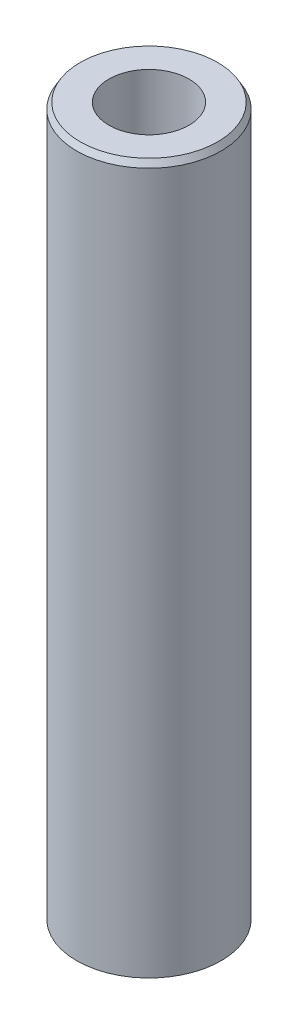
from build123d import *
from OCP.BRepFilletAPI import BRepFilletAPI_MakeChamfer

# Parameters (mm, degrees)
SKETCH1_R           = 15
BOSS_EXTRUDE1_DEPTH = 147.478424563
SKETCH2_R           = 8.311305662
CUT_EXTRUDE1_DEPTH  = 149.99626073
CHAMFER1_SIZE       = 1.275532742
CHAMFER1_SIZE2      = 0.736429172


with BuildPart() as part:
    # Sketch1 → Boss-Extrude1 (new body)
    with BuildSketch(Plane(origin=(0, 0, 0), x_dir=(1, 0, 0), z_dir=(0, 1, 0))):
        Circle(SKETCH1_R)
    extrude(amount=BOSS_EXTRUDE1_DEPTH)

    # Sketch2 → Cut-Extrude1 (cut, through all)
    with BuildSketch(Plane(origin=(0, 0, 0), x_dir=(1, 0, 0), z_dir=(0, 1, 0))):
        Circle(SKETCH2_R)
    extrude(amount=CUT_EXTRUDE1_DEPTH, mode=Mode.SUBTRACT)

    # Chamfer1: one chamfer whose edges measure the first distance from different faces: ONE call of the kernel's chamfer builder (chamfer() names one face for all edges)
    chamfer1_edges_1 = [part.edges().sort_by_distance(p)[0] for p in [
        (-15, 147.478424563, 0),
    ]]
    chamfer1_side_1 = [part.faces().sort_by_distance(p)[0] for p in [
        (-15, 73.739212281, 0),
    ]]
    chamfer1_edges_2 = [part.edges().sort_by_distance(p)[0] for p in [
        (-15, 0, 0),
    ]]
    chamfer1_side_2 = [part.faces().sort_by_distance(p)[0] for p in [
        (-14.575735931, 0, 0),
    ]]
    chamfer1 = BRepFilletAPI_MakeChamfer(part.part.solid().wrapped)
    for e in chamfer1_edges_1:
        chamfer1.Add(CHAMFER1_SIZE, CHAMFER1_SIZE2, e.wrapped, chamfer1_side_1[0].wrapped)  # the first distance lies on this face
    for e in chamfer1_edges_2:
        chamfer1.Add(CHAMFER1_SIZE, CHAMFER1_SIZE2, e.wrapped, chamfer1_side_2[0].wrapped)  # the first distance lies on this face
    add(Compound.cast(chamfer1.Shape()), mode=Mode.REPLACE)


solid = part.part
